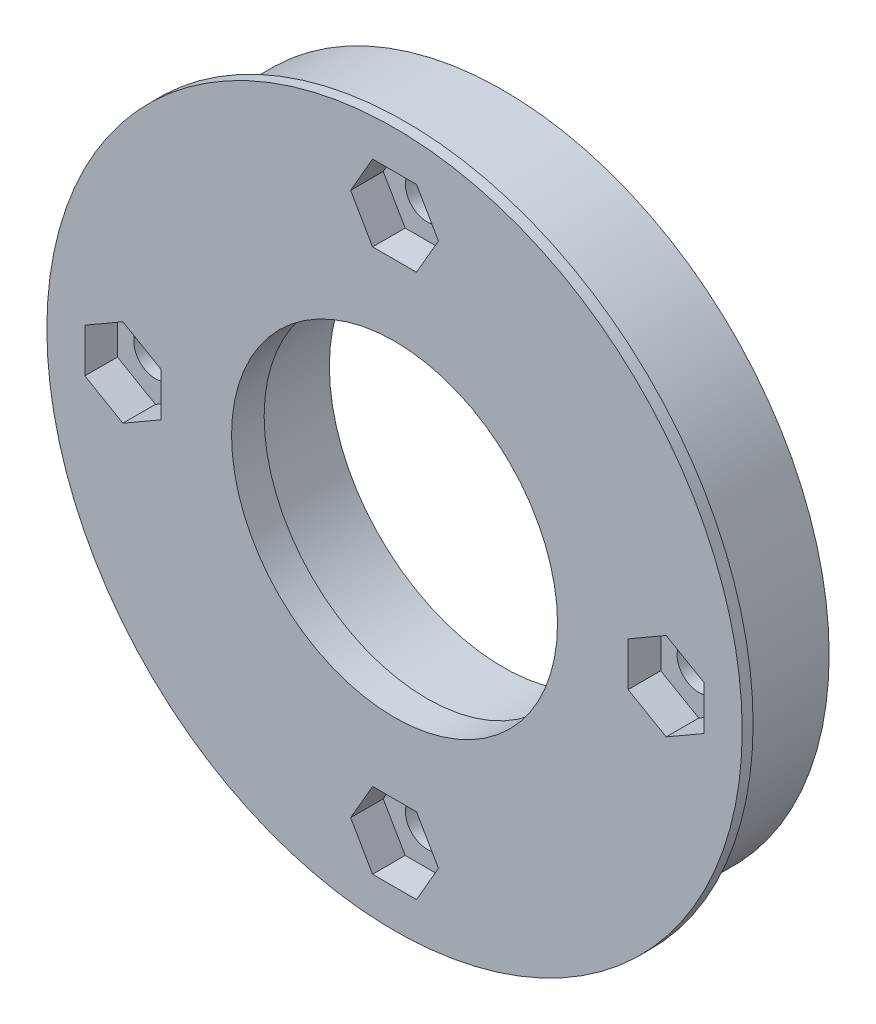
from build123d import *

# Parameters (mm, degrees)
SKETCH1_R           = 29.9974
SKETCH1_R_2         = 16
BOSS_EXTRUDE1_DEPTH = 7
SKETCH2_R           = 2
CUT_EXTRUDE1_DEPTH  = 10
SKETCH3_R           = 16
SKETCH3_R_2         = 15
BOSS_EXTRUDE2_DEPTH = 1
BOSS_EXTRUDE3_START = 3
SKETCH1_3_R         = 29.9974
SKETCH1_3_R_2       = 16
BOSS_EXTRUDE3_DEPTH = 3
BOSS_EXTRUDE4_START = 2
SKETCH3_2_R         = 16
SKETCH3_2_R_2       = 15
BOSS_EXTRUDE4_DEPTH = 2
SKETCH4_R           = 31.9974
SKETCH4_R_2         = 29.9974
BOSS_EXTRUDE5_DEPTH = 1
CUT_EXTRUDE3_START  = -1
SKETCH5_R           = 16
SKETCH5_R_2         = 15
CUT_EXTRUDE3_DEPTH  = 1
SKETCH6_R           = 3
SKETCH6_R_2         = 2
BOSS_EXTRUDE6_DEPTH = 3
CHAMFER1_SIZE       = 3
CUT_EXTRUDE4_START  = -10
SKETCH7_R           = 2
CUT_EXTRUDE4_DEPTH  = 10
BOSS_EXTRUDE7_START = 1
SKETCH8_R           = 16
SKETCH8_R_2         = 15
BOSS_EXTRUDE7_DEPTH = 1
CUT_EXTRUDE6_DEPTH  = 3


# Read off the part's stored shape, not the designer's step: Cut-Extrude5
with BuildPart() as part:
    # Sketch1 → Boss-Extrude1 (new body)
    with BuildSketch(Plane.XY):
        Circle(SKETCH1_R)
        Circle(SKETCH1_R_2, mode=Mode.SUBTRACT)
    extrude(amount=-BOSS_EXTRUDE1_DEPTH)

    # Sketch2 → Cut-Extrude1 (cut)
    with BuildSketch(Plane.XY):
        with Locations((25, 0)):
            Circle(SKETCH2_R)
        with Locations((0, -25)):
            Circle(SKETCH2_R)
        with Locations((-25, 0)):
            Circle(SKETCH2_R)
        with Locations((0, 25)):
            Circle(SKETCH2_R)
    extrude(amount=-CUT_EXTRUDE1_DEPTH, mode=Mode.SUBTRACT)

    # Sketch3 → Boss-Extrude2 (add)
    with BuildSketch(Plane.XY):
        Circle(SKETCH3_R)
        Circle(SKETCH3_R_2, mode=Mode.SUBTRACT)
    extrude(amount=-BOSS_EXTRUDE2_DEPTH)

    # Sketch1<3> → Boss-Extrude3 (add)
    with BuildSketch(Plane.XY.offset(BOSS_EXTRUDE3_START)):
        Circle(SKETCH1_3_R)
        Circle(SKETCH1_3_R_2, mode=Mode.SUBTRACT)
    extrude(amount=-BOSS_EXTRUDE3_DEPTH)

    # Sketch3<2> → Boss-Extrude4 (add)
    with BuildSketch(Plane.XY.offset(BOSS_EXTRUDE4_START)):
        Circle(SKETCH3_2_R)
        Circle(SKETCH3_2_R_2, mode=Mode.SUBTRACT)
    extrude(amount=-BOSS_EXTRUDE4_DEPTH)

    # Sketch4 → Boss-Extrude5 (add)
    with BuildSketch(Plane.XY.offset(3)):
        Circle(SKETCH4_R)
        Circle(SKETCH4_R_2, mode=Mode.SUBTRACT)
    extrude(amount=-BOSS_EXTRUDE5_DEPTH)

    # Sketch5 → Cut-Extrude3 (cut)
    with BuildSketch(Plane(origin=(0, 0, -1), x_dir=(-1, 0, 0), z_dir=(0, 0, -1)).offset(CUT_EXTRUDE3_START)):
        with Locations(Location((0, 0, 0), (0, 0, 180))):
            Circle(SKETCH5_R)
        with Locations(Location((0, 0, 0), (0, 0, 180))):
            Circle(SKETCH5_R_2, mode=Mode.SUBTRACT)
    extrude(amount=CUT_EXTRUDE3_DEPTH, mode=Mode.SUBTRACT)

    # Sketch6 → Boss-Extrude6 (add)
    # profile 1 of 4: a face of its own
    with BuildSketch(Plane(origin=(0, 0, -7), x_dir=(-1, 0, 0), z_dir=(0, 0, -1))):
        with Locations(Location((-25, 0, 0), (0, 0, 180))):
            Circle(SKETCH6_R)
        with Locations(Location((-25, 0, 0), (0, 0, 180))):
            Circle(SKETCH6_R_2, mode=Mode.SUBTRACT)
    # profile 2 of 4: a face of its own
    with BuildSketch(Plane(origin=(0, 0, -7), x_dir=(-1, 0, 0), z_dir=(0, 0, -1))):
        with Locations(Location((0, -25, 0), (0, 0, 180))):
            Circle(SKETCH6_R)
        with Locations(Location((0, -25, 0), (0, 0, 180))):
            Circle(SKETCH6_R_2, mode=Mode.SUBTRACT)
    # profile 3 of 4: a face of its own
    with BuildSketch(Plane(origin=(0, 0, -7), x_dir=(-1, 0, 0), z_dir=(0, 0, -1))):
        with Locations(Location((25, 0, 0), (0, 0, 180))):
            Circle(SKETCH6_R)
        with Locations(Location((25, 0, 0), (0, 0, 180))):
            Circle(SKETCH6_R_2, mode=Mode.SUBTRACT)
    # profile 4 of 4: a face of its own
    with BuildSketch(Plane(origin=(0, 0, -7), x_dir=(-1, 0, 0), z_dir=(0, 0, -1))):
        with Locations(Location((0, 25, 0), (0, 0, 180))):
            Circle(SKETCH6_R)
        with Locations(Location((0, 25, 0), (0, 0, 180))):
            Circle(SKETCH6_R_2, mode=Mode.SUBTRACT)
    extrude(amount=BOSS_EXTRUDE6_DEPTH)

    # Chamfer1
    # the kernel refuses this chamfer: 3 mm, written as the material it adds along each edge
    with BuildSketch(Plane(origin=(25, 0, -7), x_dir=(1, 0, 0), z_dir=(0, 1, 0))) as chamfer1_piece_1_section:
        Polygon((3 + CHAMFER1_SIZE, 0), (3, CHAMFER1_SIZE), (3, 0), align=None)
    chamfer1_piece_1 = revolve(axis=Axis((25, 0, -7), (0, 0, -1)), mode=Mode.PRIVATE)
    chamfer1_piece_1 = chamfer1_piece_1 & Plane(origin=(0, 0, -8.42256149), x_dir=(1, 0, 0), z_dir=(0, 0, 1)) * Cylinder(29.9974, 25, mode=Mode.PRIVATE)
    chamfer1_piece_1 = split(chamfer1_piece_1, bisect_by=Plane(origin=(20.492585696, 0, -10), z_dir=(0, 0, 1)), keep=Keep.TOP, mode=Mode.PRIVATE)
    add(chamfer1_piece_1)
    with BuildSketch(Plane(origin=(0, -25, -7), x_dir=(1, 0, 0), z_dir=(0, 1, 0))) as chamfer1_piece_2_section:
        Polygon((3 + CHAMFER1_SIZE, 0), (3, CHAMFER1_SIZE), (3, 0), align=None)
    chamfer1_piece_2 = revolve(axis=Axis((0, -25, -7), (0, 0, -1)), mode=Mode.PRIVATE)
    chamfer1_piece_2 = chamfer1_piece_2 & Plane(origin=(0, 0, -8.422561428), x_dir=(1, 0, 0), z_dir=(0, 0, 1)) * Cylinder(29.9974, 25, mode=Mode.PRIVATE)
    chamfer1_piece_2 = split(chamfer1_piece_2, bisect_by=Plane(origin=(-4.507414242, -25, -10), z_dir=(0, 0, 1)), keep=Keep.TOP, mode=Mode.PRIVATE)
    add(chamfer1_piece_2)
    with BuildSketch(Plane(origin=(-25, 0, -7), x_dir=(1, 0, 0), z_dir=(0, 1, 0))) as chamfer1_piece_3_section:
        Polygon((3 + CHAMFER1_SIZE, 0), (3, CHAMFER1_SIZE), (3, 0), align=None)
    chamfer1_piece_3 = revolve(axis=Axis((-25, 0, -7), (0, 0, -1)), mode=Mode.PRIVATE)
    chamfer1_piece_3 = chamfer1_piece_3 & Plane(origin=(0, 0, -8.422561427), x_dir=(1, 0, 0), z_dir=(0, 0, 1)) * Cylinder(29.9974, 25, mode=Mode.PRIVATE)
    chamfer1_piece_3 = split(chamfer1_piece_3, bisect_by=Plane(origin=(-29.507414241, 0, -10), z_dir=(0, 0, 1)), keep=Keep.TOP, mode=Mode.PRIVATE)
    add(chamfer1_piece_3)
    with BuildSketch(Plane(origin=(0, 25, -7), x_dir=(1, 0, 0), z_dir=(0, 1, 0))) as chamfer1_piece_4_section:
        Polygon((3 + CHAMFER1_SIZE, 0), (3, CHAMFER1_SIZE), (3, 0), align=None)
    chamfer1_piece_4 = revolve(axis=Axis((0, 25, -7), (0, 0, -1)), mode=Mode.PRIVATE)
    chamfer1_piece_4 = chamfer1_piece_4 & Plane(origin=(0, 0, -8.422561436), x_dir=(1, 0, 0), z_dir=(0, 0, 1)) * Cylinder(29.9974, 25, mode=Mode.PRIVATE)
    chamfer1_piece_4 = split(chamfer1_piece_4, bisect_by=Plane(origin=(-4.50741425, 25, -10), z_dir=(0, 0, 1)), keep=Keep.TOP, mode=Mode.PRIVATE)
    add(chamfer1_piece_4)

    # Sketch7 → Cut-Extrude4 (cut)
    with BuildSketch(Plane(origin=(0, 0, 0), x_dir=(-1, 0, 0), z_dir=(0, 0, -1)).offset(CUT_EXTRUDE4_START)):
        with Locations(Location((-25, 0, 0), (0, 0, 180))):
            Circle(SKETCH7_R)
        with Locations(Location((0, 25, 0), (0, 0, 180))):
            Circle(SKETCH7_R)
        with Locations(Location((25, 0, 0), (0, 0, 180))):
            Circle(SKETCH7_R)
        with Locations(Location((0, -25, 0), (0, 0, 180))):
            Circle(SKETCH7_R)
    extrude(amount=CUT_EXTRUDE4_DEPTH, mode=Mode.SUBTRACT)

    # Sketch8 → Boss-Extrude7 (add)
    with BuildSketch(Plane.XY.offset(2).offset(BOSS_EXTRUDE7_START)):
        Circle(SKETCH8_R)
        Circle(SKETCH8_R_2, mode=Mode.SUBTRACT)
    extrude(amount=-BOSS_EXTRUDE7_DEPTH)

    # Cut-Extrude5 outline → Cut-Extrude5 (revolve, cut)
    with BuildSketch(Plane(origin=(25, 0, 0), x_dir=(1, 0, 0), z_dir=(0, -1, 0))):
        Polygon((2, -7), (2, -10), (3, -10), (6, -7), align=None)
    revolve(axis=Axis((25, 0, 0), (0, 0, 1)), mode=Mode.SUBTRACT)

    # Cut-Extrude5 2 outline → Cut-Extrude5 2 (revolve, cut)
    with BuildSketch(Plane.XZ.offset(25)):
        Polygon((2, -7), (2, -10), (3, -10), (6, -7), align=None)
    revolve(axis=Axis((0, -25, 0), (0, 0, 1)), mode=Mode.SUBTRACT)

    # Cut-Extrude5 3 outline → Cut-Extrude5 3 (revolve, cut)
    with BuildSketch(Plane(origin=(-25, 0, 0), x_dir=(1, 0, 0), z_dir=(0, -1, 0))):
        Polygon((2, -7), (2, -10), (3, -10), (6, -7), align=None)
    revolve(axis=Axis((-25, 0, 0), (0, 0, 1)), mode=Mode.SUBTRACT)

    # Cut-Extrude5 4 outline → Cut-Extrude5 4 (revolve, cut)
    with BuildSketch(Plane.XZ.offset(-25)):
        Polygon((2, -7), (2, -10), (3, -10), (6, -7), align=None)
    revolve(axis=Axis((0, 25, 0), (0, 0, 1)), mode=Mode.SUBTRACT)

    # Sketch10 → Cut-Extrude6 (cut)
    with BuildSketch(Plane.XY.offset(3)):
        Polygon((-4.041451884, -25), (-2.020725942, -28.5), (2.020725942, -28.5), (4.041451884, -25), (2.020725942, -21.5), (-2.020725942, -21.5), align=None)
        Polygon((25, -4.041451884), (28.5, -2.020725942), (28.5, 2.020725942), (25, 4.041451884), (21.5, 2.020725942), (21.5, -2.020725942), align=None)
        Polygon((-25, 4.041451884), (-28.5, 2.020725942), (-28.5, -2.020725942), (-25, -4.041451884), (-21.5, -2.020725942), (-21.5, 2.020725942), align=None)
        Polygon((4.041451884, 25), (2.020725942, 28.5), (-2.020725942, 28.5), (-4.041451884, 25), (-2.020725942, 21.5), (2.020725942, 21.5), align=None)
    extrude(amount=-CUT_EXTRUDE6_DEPTH, mode=Mode.SUBTRACT)


solid = part.part
